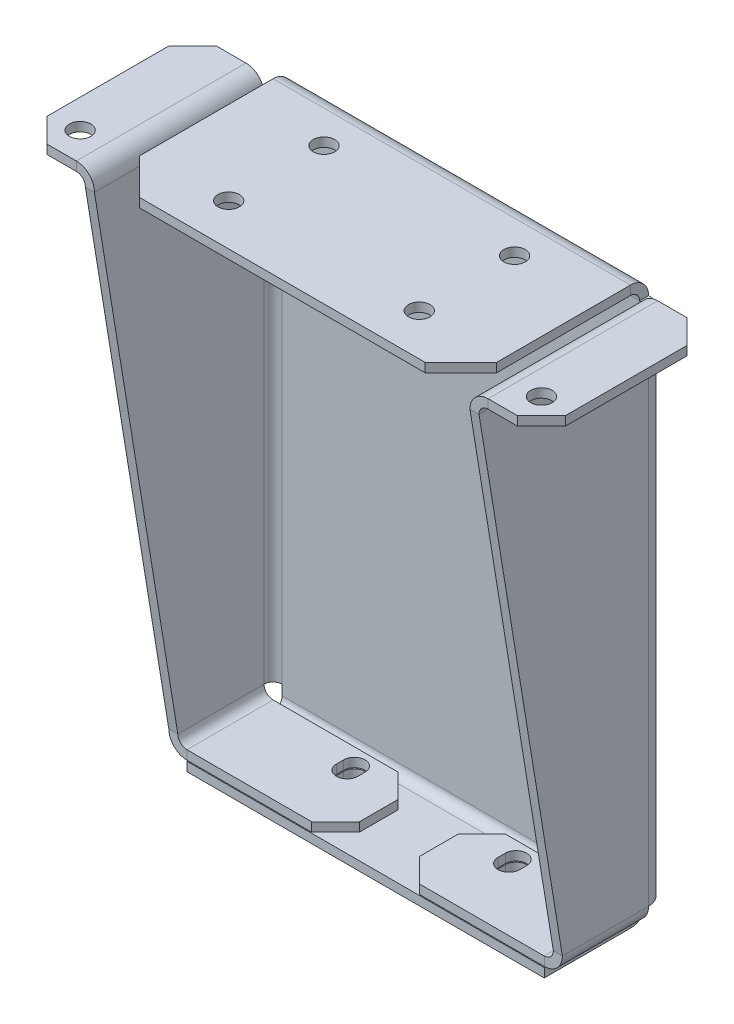
from build123d import *

# Parameters (mm, degrees)
SKETCH1_W                    = 75
SKETCH1_H                    = 75
BASE_FLANGE1_DEPTH           = 3.7973
EDGE_FLANGE1_STRIP_W         = 22.8092
EDGE_FLANGE1_STRIP_H         = 3.7973
EDGE_FLANGE1_STRIP_CUT_DEPTH = 75
EDGE_FLANGE1_DEPTH           = 75
EDGE_FLANGE2_STRIP_W         = 22.8092
EDGE_FLANGE2_STRIP_H         = 3.7973
EDGE_FLANGE2_STRIP_CUT_DEPTH = 75
EDGE_FLANGE2_DEPTH           = 75
EDGE_FLANGE3_DEPTH           = 214.38618
EDGE_FLANGE3_START           = -3.7973
EDGE_FLANGE3_FLAT_DEPTH      = 3.7973
EDGE_FLANGE4_DEPTH           = 71.19
EDGE_FLANGE5_DEPTH           = 36.19
BREAK_CORNER1_START          = -222.755
BREAK_CORNER1_DEPTH          = 3.7973
BREAK_CORNER2_START          = -74.246212025
BREAK_CORNER2_OUTLINE_W      = 51.869221049
BREAK_CORNER2_OUTLINE_H      = 3.7973
BREAK_CORNER2_DEPTH          = 7.071067812
BREAK_CORNER2_START_2        = -30.978348084
BREAK_CORNER2_2_OUTLINE_W    = 7.130778951
BREAK_CORNER2_2_OUTLINE_H    = 3.7973
BREAK_CORNER2_2_DEPTH        = 14.142135624
M8_CLEARANCE_HOLE1_D         = 9
M8_CLEARANCE_HOLE1_DEPTH     = 13
M8_CLEARANCE_HOLE1_TIP       = 2.703872786
BREAK_CORNER3_START          = 3.04848
BREAK_CORNER3_DEPTH          = 3.7973
M8_START                     = -226.945
M8_CLEARANCE_SLOT1_DEPTH     = 7.9873


# Read off the part's stored shape, not the designer's step: Break-Corner1, Break-Corner2, Break-Corner3, M8 Clearance Slot1
# Sheet-metal steps are written as plain solids
with BuildPart() as part:
    # Sketch1 → Base-Flange1 (new body)
    with BuildSketch(Plane(origin=(0, 6.84578, 0), x_dir=(1, 0, 0), z_dir=(0, 1, 0))):
        Rectangle(SKETCH1_W, SKETCH1_H)
    extrude(amount=-BASE_FLANGE1_DEPTH)

    # Edge-Flange1 strip (across the edge) → Edge-Flange1 strip cut (cut)
    with BuildSketch(Plane(origin=(-37.5, 3.04848, -37.5), x_dir=(0, 0, 1), z_dir=(1, 0, 0))):
        with Locations((-7.5946, -1.89865)):
            Rectangle(EDGE_FLANGE1_STRIP_W, EDGE_FLANGE1_STRIP_H)
    extrude(amount=EDGE_FLANGE1_STRIP_CUT_DEPTH, mode=Mode.SUBTRACT)

    # Edge-Flange1 section (across the edge) → Edge-Flange1 (add)
    with BuildSketch(Plane(origin=(-37.5, 3.04848, -37.5), x_dir=(0, 0, 1), z_dir=(1, 0, 0))):
        with BuildLine():
            Line((-3.7973, 3.81), (-3.7973, 229.99348))
            Line((-3.7973, 229.99348), (0, 229.99348))
            Line((0, 229.99348), (0, 3.81))
            ThreePointArc((0, 3.81), (1.115923164, 1.115923164), (3.81, 0))
            Line((3.81, 0), (3.81, -3.7973))
            ThreePointArc((3.81, -3.7973), (-1.569173417, -1.569173417), (-3.7973, 3.81))
        make_face()
    extrude(amount=EDGE_FLANGE1_DEPTH)

    # Edge-Flange2 strip (across the edge) → Edge-Flange2 strip cut (cut)
    with BuildSketch(Plane(origin=(-37.5, -226.945, -37.5), x_dir=(0, 1, 0), z_dir=(1, 0, 0))):
        with Locations((-3.7973, -1.89865)):
            Rectangle(EDGE_FLANGE2_STRIP_W, EDGE_FLANGE2_STRIP_H)
    extrude(amount=EDGE_FLANGE2_STRIP_CUT_DEPTH, mode=Mode.SUBTRACT)

    # Edge-Flange2 section (across the edge) → Edge-Flange2 (add)
    with BuildSketch(Plane(origin=(-37.5, -226.945, -37.5), x_dir=(0, 1, 0), z_dir=(1, 0, 0))):
        with BuildLine():
            Line((0, 3.81), (0, 40))
            Line((0, 40), (3.7973, 40))
            Line((3.7973, 40), (3.7973, 3.81))
            ThreePointArc((3.7973, 3.81), (4.913223164, 1.115923164), (7.6073, 0))
            Line((7.6073, 0), (7.6073, -3.7973))
            ThreePointArc((7.6073, -3.7973), (2.228126583, -1.569173417), (0, 3.81))
        make_face()
    extrude(amount=EDGE_FLANGE2_DEPTH)

    # Edge-Flange3 bend section (across the edge) → Edge-Flange3 (add)
    with BuildSketch(Plane(origin=(-41.31, -0.76152, -37.5), x_dir=(1, 0, 0), z_dir=(0, -1, 0))):
        with BuildLine():
            Line((-3.7973, 3.81), (0, 3.81))
            ThreePointArc((0, 3.81), (1.115923164, 1.115923164), (3.81, 0))
            Line((3.81, 0), (3.81, -3.7973))
            ThreePointArc((3.81, -3.7973), (-1.569173417, -1.569173417), (-3.7973, 3.81))
        make_face()
    extrude(amount=EDGE_FLANGE3_DEPTH)

    # Edge-Flange3 profile (on flange) → Edge-Flange3 flat (add)
    with BuildSketch(Plane(origin=(-41.31, 0, -37.5), x_dir=(0, 1, 0), z_dir=(1, 0, 0)).offset(EDGE_FLANGE3_START)):
        Polygon((-215.1477, 3.81), (-0.76152, 3.81), (-0.76152, 75), (-215.1477, 40), align=None)
    extrude(amount=EDGE_FLANGE3_FLAT_DEPTH)

    # Edge-Flange4 section (across the edge) → Edge-Flange4 (add)
    with BuildSketch(Plane(origin=(-45.1073, 3.04848, 37.5), x_dir=(0, -1, 0), z_dir=(0, 0, -1))):
        with BuildLine():
            Line((-3.7973, 3.81), (-3.7973, 26.2027))
            Line((-3.7973, 26.2027), (0, 26.2027))
            Line((0, 26.2027), (0, 3.81))
            ThreePointArc((0, 3.81), (1.115923164, 1.115923164), (3.81, 0))
            Line((3.81, 0), (3.81, -3.7973))
            ThreePointArc((3.81, -3.7973), (-1.569173417, -1.569173417), (-3.7973, 3.81))
        make_face()
    extrude(amount=EDGE_FLANGE4_DEPTH)

    # Edge-Flange5 section (across the edge) → Edge-Flange5 (add)
    with BuildSketch(Plane(origin=(-41.31, -218.9577, 2.5), x_dir=(0, 1, 0), z_dir=(0, 0, -1))):
        with BuildLine():
            Line((-3.7973, 3.81), (-3.7973, 66.2027))
            Line((-3.7973, 66.2027), (0, 66.2027))
            Line((0, 66.2027), (0, 3.81))
            ThreePointArc((0, 3.81), (1.115923164, 1.115923164), (3.81, 0))
            Line((3.81, 0), (3.81, -3.7973))
            ThreePointArc((3.81, -3.7973), (-1.569173417, -1.569173417), (-3.7973, 3.81))
        make_face()
    extrude(amount=EDGE_FLANGE5_DEPTH)

    # Break-Corner1 outline → Break-Corner1 (cut)
    with BuildSketch(Plane(origin=(0, 0, 0), x_dir=(1, 0, 0), z_dir=(0, 1, 0)).offset(BREAK_CORNER1_START)):
        Polygon((24.8927, -2.5), (24.8927, 7.5), (14.8927, -2.5), align=None)
        Polygon((14.8927, 33.69), (24.8927, 23.69), (24.8927, 33.69), align=None)
    extrude(amount=BREAK_CORNER1_DEPTH, mode=Mode.SUBTRACT)

    # Break-Corner2 outline → Break-Corner2 (cut)
    with BuildSketch(Plane(origin=(0, 0, 0), x_dir=(0.707106781186549, 0, -0.707106781186546), z_dir=(0.707106781186546, 0, 0.707106781186549)).offset(BREAK_CORNER2_START)):
        with Locations((-43.934610525, 4.94713)):
            Rectangle(BREAK_CORNER2_OUTLINE_W, BREAK_CORNER2_OUTLINE_H)
    extrude(amount=BREAK_CORNER2_DEPTH, mode=Mode.SUBTRACT)

    # Break-Corner2 2 outline → Break-Corner2 2 (cut)
    with BuildSketch(Plane(origin=(0, 0, 0), x_dir=(0.707106781186549, 0, -0.707106781186546), z_dir=(0.707106781186546, 0, 0.707106781186549)).offset(BREAK_CORNER2_START_2)):
        with Locations((-73.434610525, 4.94713)):
            Rectangle(BREAK_CORNER2_2_OUTLINE_W, BREAK_CORNER2_2_OUTLINE_H)
    extrude(amount=BREAK_CORNER2_2_DEPTH, mode=Mode.SUBTRACT)

    # M8 Clearance Hole1
    with Locations(Plane(origin=(0, 6.84578, 0), x_dir=(1, 0, 0), z_dir=(0, 1, 0))):
        with Locations((-2.5, -19.962925734), (-2.5, 20.037074266), (-59.31, -25.5)):
            Hole(M8_CLEARANCE_HOLE1_D / 2, depth=M8_CLEARANCE_HOLE1_DEPTH)
            with Locations((0, 0, -(M8_CLEARANCE_HOLE1_DEPTH + M8_CLEARANCE_HOLE1_TIP / 2))):  # 118° drill point
                Cone(0, M8_CLEARANCE_HOLE1_D / 2, M8_CLEARANCE_HOLE1_TIP, mode=Mode.SUBTRACT)

    # Mirror1: part across plane


with BuildPart() as part_1:
    add(part.part)
    add(part.part.mirror(Plane(origin=(37.5, 3.04848, -41.2973), x_dir=(0, 0, 1), z_dir=(1, 0, 0))))

    # Break-Corner3 outline → Break-Corner3 (cut)
    with BuildSketch(Plane(origin=(0, 0, 0), x_dir=(1, 0, 0), z_dir=(0, 1, 0)).offset(BREAK_CORNER3_START)):
        Polygon((-37.5, -37.5), (-22.5, -37.5), (-37.5, -22.5), align=None)
        Polygon((112.5, -22.5), (97.5, -37.5), (112.5, -37.5), align=None)
    extrude(amount=BREAK_CORNER3_DEPTH, mode=Mode.SUBTRACT)

    # M8 Clearance Slot1 outline → M8 Clearance Slot1 (cut)
    with BuildSketch(Plane(origin=(0, 0, 0), x_dir=(1, 0, 0), z_dir=(0, 1, 0)).offset(M8_START)):
        with BuildLine():
            ThreePointArc((-0.9328125, 23.696875), (3.5671875, 19.196875), (8.0671875, 23.696875))
            Line((8.0671875, 23.696875), (8.0671875, 26.696875))
            ThreePointArc((8.0671875, 26.696875), (3.5671875, 31.196875), (-0.9328125, 26.696875))
            Line((-0.9328125, 26.696875), (-0.9328125, 23.696875))
        make_face()
        with BuildLine():
            ThreePointArc((66.9328125, 23.696875), (71.4328125, 19.196875), (75.9328125, 23.696875))
            Line((75.9328125, 23.696875), (75.9328125, 26.696875))
            ThreePointArc((75.9328125, 26.696875), (71.4328125, 31.196875), (66.9328125, 26.696875))
            Line((66.9328125, 26.696875), (66.9328125, 23.696875))
        make_face()
    extrude(amount=M8_CLEARANCE_SLOT1_DEPTH, mode=Mode.SUBTRACT)


solid = part_1.part
